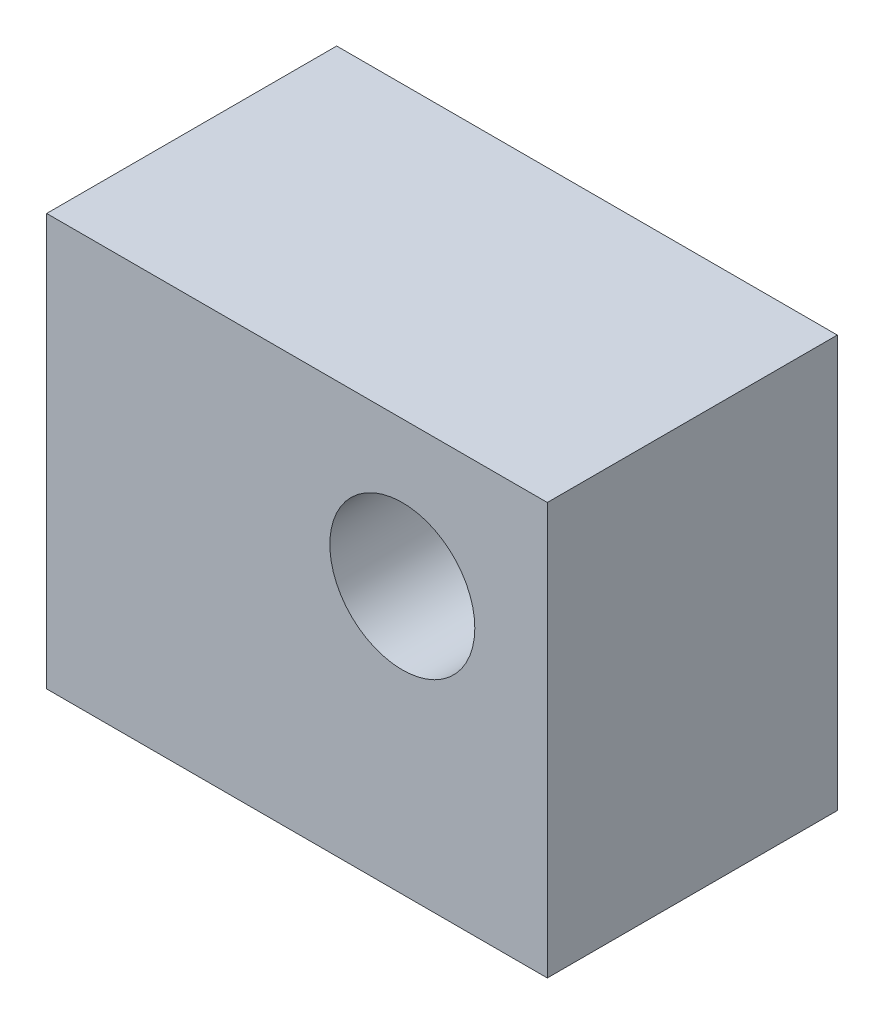
from build123d import *

# Parameters (mm, degrees)
SKETCH3_W                      = 21.924187445
SKETCH3_H                      = 19.837641971
BOSS_EXTRUDE1_DEPTH            = 6.35
SKETCH4_R                      = 3.175
CUT_EXTRUDE1_DEPTH             = 9.525
SKETCH5_R                      = 3.175
CUT_EXTRUDE5_DEPTH             = 9.525
CUT_EXTRUDE5_DIRECTION_2_REACH = 27.174
SKETCH6_R                      = 3.175
CUT_EXTRUDE6_DEPTH             = 9.525
SKETCH7_W                      = 12.7
SKETCH7_H                      = 1.803641971
CUT_EXTRUDE8_DEPTH             = 31.241106695


with BuildPart() as part:
    # Sketch3 → Boss-Extrude1 (new, symmetric)
    with BuildSketch(Plane.XY):
        with Locations((10.962093723, -9.918820986)):
            Rectangle(SKETCH3_W, SKETCH3_H)
    extrude(amount=BOSS_EXTRUDE1_DEPTH, both=True)

    # Sketch4 → Cut-Extrude1 (cut)
    with BuildSketch(Plane.ZY):
        with Locations((0, -6.35)):
            Circle(SKETCH4_R)
    extrude(amount=-CUT_EXTRUDE1_DEPTH, mode=Mode.SUBTRACT)

    # Sketch5 → Cut-Extrude5 (cut)
    with BuildSketch(Plane(origin=(7.787093723, -19.837641971, 0), x_dir=(-0.8660254037844382, 0.500000000000001, 0), z_dir=(-0.500000000000001, -0.8660254037844382, 0))):
        Circle(SKETCH5_R)
    extrude(amount=-CUT_EXTRUDE5_DEPTH, mode=Mode.SUBTRACT)

    # Sketch5 → Cut-Extrude5 direction 2 (cut, up to next)
    with BuildSketch(Plane(origin=(7.787093723, -19.837641971, 0), x_dir=(-0.8660254037844382, 0.500000000000001, 0), z_dir=(-0.500000000000001, -0.8660254037844382, 0)), mode=Mode.PRIVATE) as cut_extrude5_direction_2_sk1:
        Circle(SKETCH5_R)
    cut_extrude5_direction_2_tool1 = extrude(cut_extrude5_direction_2_sk1.sketch, amount=CUT_EXTRUDE5_DIRECTION_2_REACH, mode=Mode.PRIVATE) & part.part
    add(cut_extrude5_direction_2_tool1.solids().sort_by_distance((7.787094, -19.837642, 0))[0], mode=Mode.SUBTRACT)

    # Sketch6 → Cut-Extrude6 (cut)
    with BuildSketch(Plane(origin=(0, 0, 6.35), x_dir=(-1, 0, 0), z_dir=(0, 0, -1))):
        with Locations((-15.574187445, -6.35)):
            Circle(SKETCH6_R)
    extrude(amount=CUT_EXTRUDE6_DEPTH, mode=Mode.SUBTRACT)

    # Sketch7 → Cut-Extrude8 (cut, through all)
    with BuildSketch(Plane(origin=(21.924187445, 0, 0), x_dir=(0, 0, -1), z_dir=(1, 0, 0))):
        with Locations((0, -18.935820986)):
            Rectangle(SKETCH7_W, SKETCH7_H)
    extrude(amount=-CUT_EXTRUDE8_DEPTH, mode=Mode.SUBTRACT)


solid = part.part
